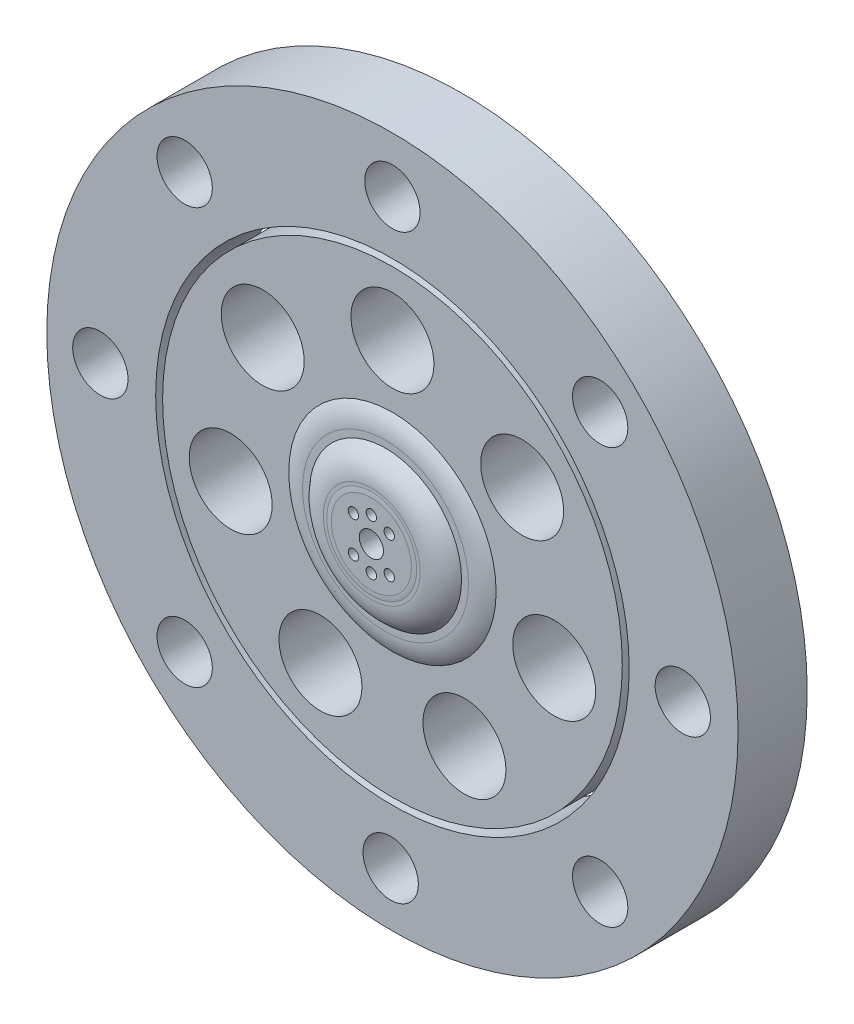
from build123d import *

# Parameters (mm, degrees)
BOSS_EXTRUDE1_DEPTH      = 10
BOSS_EXTRUDE1_DEPTH_BACK = 10
SKETCH1_R                = 100
SKETCH1_R_2              = 8
SKETCH4_R                = 30
BOSS_EXTRUDE2_DEPTH      = 12
SKETCH5_R                = 22
BOSS_EXTRUDE3_DEPTH      = 4
SKETCH6_R                = 13
BOSS_EXTRUDE4_DEPTH      = 0.1
SKETCH2_R                = 68.5
SKETCH2_R_2              = 66.5
CUT_EXTRUDE11_DEPTH      = 66
SKETCH7_R                = 12
CUT_EXTRUDE12_DEPTH      = 31
SKETCH9_R                = 8
CUT_EXTRUDE13_DEPTH      = 31
SKETCH10_R               = 1.5
SKETCH10_R_2             = 3.5
CUT_EXTRUDE14_DEPTH      = 31
FILLET5_R                = 10


with BuildPart() as part:
    # Sketch1 → Boss-Extrude1 (new, two sides: drawn at the far end of the back side and taken through both)
    with BuildSketch(Plane.XY.offset(-BOSS_EXTRUDE1_DEPTH_BACK)):
        Circle(SKETCH1_R)
        with Locations((0, 84)):
            Circle(SKETCH1_R_2, mode=Mode.SUBTRACT)
        with Locations((84, -0.507247964)):
            Circle(SKETCH1_R_2, mode=Mode.SUBTRACT)
        with Locations((-0.507247964, -84.507247964)):
            Circle(SKETCH1_R_2, mode=Mode.SUBTRACT)
        with Locations((-84.507247964, 0)):
            Circle(SKETCH1_R_2, mode=Mode.SUBTRACT)
    extrude(amount=BOSS_EXTRUDE1_DEPTH + BOSS_EXTRUDE1_DEPTH_BACK)

    # Sketch4 → Boss-Extrude2 (add)
    with BuildSketch(Plane.XY):
        Circle(SKETCH4_R)
    extrude(amount=BOSS_EXTRUDE2_DEPTH)

    # Sketch5 → Boss-Extrude3 (add)
    with BuildSketch(Plane.XY.offset(12)):
        Circle(SKETCH5_R)
    extrude(amount=BOSS_EXTRUDE3_DEPTH)

    # Sketch6 → Boss-Extrude4 (add)
    with BuildSketch(Plane.XY.offset(16)):
        Circle(SKETCH6_R)
    extrude(amount=BOSS_EXTRUDE4_DEPTH)

    # Sketch2 → Cut-Extrude11 (cut, symmetric)
    with BuildSketch(Plane.XY):
        Circle(SKETCH2_R)
        Circle(SKETCH2_R_2, mode=Mode.SUBTRACT)
    extrude(amount=CUT_EXTRUDE11_DEPTH, both=True, mode=Mode.SUBTRACT)


with BuildPart() as cut_extrude11_piece_1:
    # of the separate pieces the step leaves, piece 1, a body of its own (cut_extrude11_pieces)
    add(part.part.solids().sort_by_distance((100, 0, 0))[0])

    # Sketch9 → Cut-Extrude13 (cut, symmetric)
    with BuildSketch(Plane.XY.offset(10)):
        with Locations((-60.104076401, 60.104076401)):
            Circle(SKETCH9_R)
        with Locations((60.104076401, 60.104076401)):
            Circle(SKETCH9_R)
        with Locations((60.104076401, -60.104076401)):
            Circle(SKETCH9_R)
        with Locations((-60.104076401, -60.104076401)):
            Circle(SKETCH9_R)
    extrude(amount=CUT_EXTRUDE13_DEPTH, both=True, mode=Mode.SUBTRACT)


with BuildPart() as cut_extrude11_piece_2:
    # of the separate pieces the step leaves, piece 2, a body of its own (cut_extrude11_pieces)
    add(part.part.solids().sort_by_distance((66.5, 0, 10))[0])

    # Sketch7 → Cut-Extrude12 (cut, symmetric)
    with BuildSketch(Plane.XY.offset(10)):
        with Locations((0, 48)):
            Circle(SKETCH7_R)
        with Locations((37.527911158, 29.927510489)):
            Circle(SKETCH7_R)
        with Locations((46.796539785, -10.68100483)):
            Circle(SKETCH7_R)
        with Locations((20.826419478, -43.246505659)):
            Circle(SKETCH7_R)
        with Locations((-20.826419478, -43.246505659)):
            Circle(SKETCH7_R)
        with Locations((-46.796539785, -10.68100483)):
            Circle(SKETCH7_R)
        with Locations((-37.527911158, 29.927510489)):
            Circle(SKETCH7_R)
    extrude(amount=CUT_EXTRUDE12_DEPTH, both=True, mode=Mode.SUBTRACT)

    # Sketch10 → Cut-Extrude14 (cut, symmetric)
    with BuildSketch(Plane.XY.offset(16.1)):
        with Locations((0, 7.296037155)):
            Circle(SKETCH10_R)
        with Locations((0, -7.296037155)):
            Circle(SKETCH10_R)
        with Locations((-5.18978461, 5.177728197)):
            Circle(SKETCH10_R)
        with Locations((5.177728197, 5.18978461)):
            Circle(SKETCH10_R)
        with Locations((5.18978461, -5.177728197)):
            Circle(SKETCH10_R)
        with Locations((-5.177728197, -5.18978461)):
            Circle(SKETCH10_R)
        Circle(SKETCH10_R_2)
    extrude(amount=CUT_EXTRUDE14_DEPTH, both=True, mode=Mode.SUBTRACT)

    # Fillet5
    # the kernel refuses this fillet: 10 mm, written as the material it takes off along each edge
    with BuildSketch(Plane(origin=(0, 0, 12), x_dir=(1, 0, 0), z_dir=(0, -1, 0))) as fillet5_piece_1:
        with BuildLine():
            CenterArc((24, -10), FILLET5_R, 53.130102354, 36.869897646)
            Line((24, 0), (30, 0))
            Line((30, 0), (30, -2))
        make_face()
    revolve(axis=Axis((0, 0, 12), (0, 0, 1)), mode=Mode.SUBTRACT)
    with BuildSketch(Plane(origin=(0, 0, 16), x_dir=(1, 0, 0), z_dir=(0, -1, 0))) as fillet5_piece_2:
        with BuildLine():
            CenterArc((14, -10), FILLET5_R, 36.869897646, 53.130102354)
            Line((14, 0), (22, 0))
            Line((22, 0), (22, -4))
        make_face()
    revolve(axis=Axis((0, 0, 16), (0, 0, 1)), mode=Mode.SUBTRACT)
    with BuildSketch(Plane(origin=(0, 0, 16.1), x_dir=(1, 0, 0), z_dir=(0, -1, 0))) as fillet5_piece_3:
        with BuildLine():
            CenterArc((11.589326402, -10), FILLET5_R, 81.890385544, 8.109614456)
            Line((13, -0.1), (13, 0))
            Line((13, 0), (11.589326402, 0))
        make_face()
    revolve(axis=Axis((0, 0, 16.1), (0, 0, 1)), mode=Mode.SUBTRACT)


solid = Compound([cut_extrude11_piece_1.part, cut_extrude11_piece_2.part])
